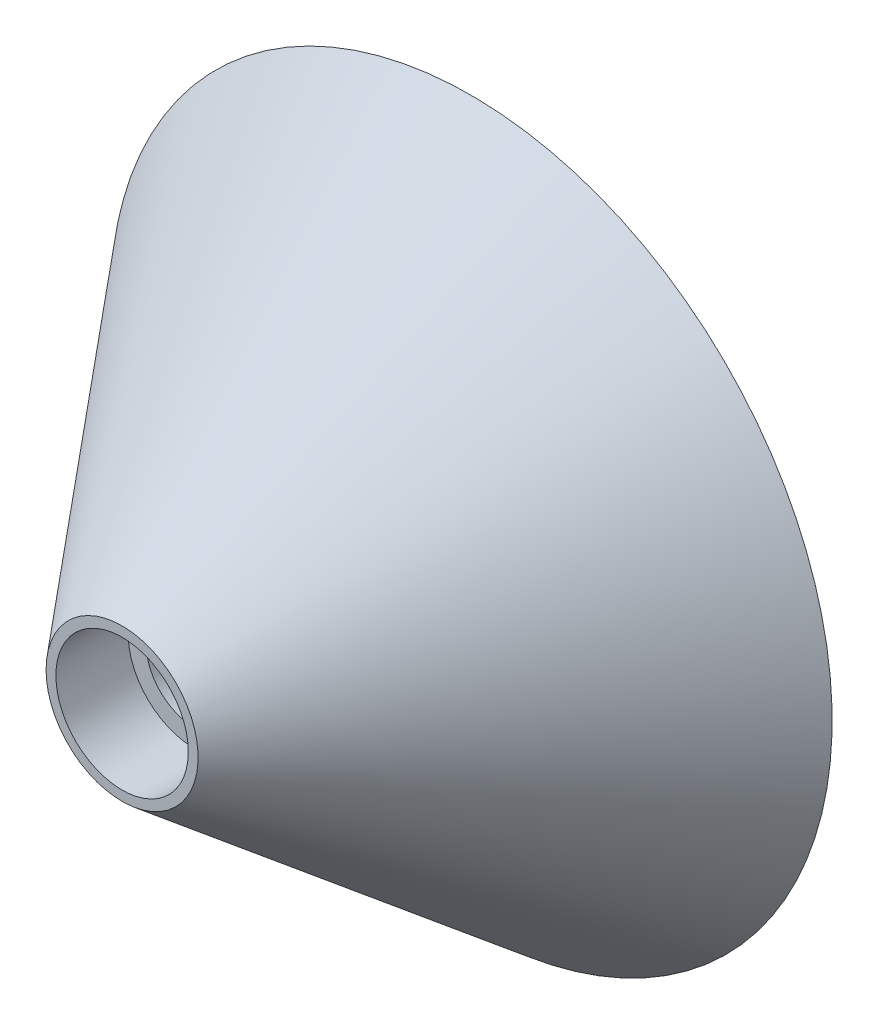
from build123d import *


with BuildPart() as part:
    # Skica1 → Rotovat1 (revolve)
    with BuildSketch(Plane(origin=(0, 0, 0), x_dir=(0, 0, -1), z_dir=(1, 0, 0))):
        Polygon((1.288336748, 5.5), (7.288336748, 5.5), (7.288336748, 4), (24.288262464, 4), (24.288262464, 5.5), (30.288262464, 5.5), (30.288262464, 30), (1.288336748, 6.316727332), align=None)
    revolve(axis=Axis((0, 0, 59.95975236), (0, 0, -1)))


solid = part.part
